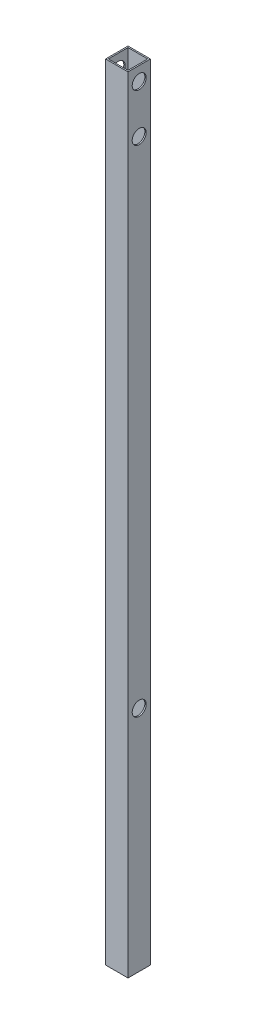
from build123d import *

# Parameters (mm, degrees)
SKETCH1_W               = 25.4
SKETCH1_H               = 25.4
SKETCH1_W_2             = 22.352
SKETCH1_H_2             = 22.352
BOSS_EXTRUDE1_DEPTH     = 889
CUT_EXTRUDE3_DEPTH      = 891.78839291
CUT_EXTRUDE3_DEPTH_BACK = 891.78839291
SKETCH5_R               = 7.9375
CUT_EXTRUDE4_DEPTH      = 891.78839291
CUT_EXTRUDE4_DEPTH_BACK = 891.78839291
SKETCH6_R               = 7.9375


with BuildPart() as part:
    # Sketch1 → Boss-Extrude1 (new body)
    with BuildSketch(Plane(origin=(0, 0, 0), x_dir=(1, 0, 0), z_dir=(0, 1, 0))):
        with Locations((-46.655111286, 37.676591231)):
            Rectangle(SKETCH1_W, SKETCH1_H)
        with Locations((-46.655111286, 37.676591231)):
            Rectangle(SKETCH1_W_2, SKETCH1_H_2, mode=Mode.SUBTRACT)
    extrude(amount=BOSS_EXTRUDE1_DEPTH)

    # Sketch5 → Cut-Extrude3 (cut, two sides: drawn at the far end of the back side and taken through both)
    with BuildSketch(Plane(origin=(-33.955111286, 0, 0), x_dir=(0, 0, -1), z_dir=(1, 0, 0)).offset(-CUT_EXTRUDE3_DEPTH_BACK)):
        with Locations((37.676591231, 258.318)):
            Circle(SKETCH5_R)
    extrude(amount=CUT_EXTRUDE3_DEPTH + CUT_EXTRUDE3_DEPTH_BACK, mode=Mode.SUBTRACT)

    # Sketch6 → Cut-Extrude4 (cut, two sides: drawn at the far end of the back side and taken through both)
    with BuildSketch(Plane(origin=(-33.955111286, 0, 0), x_dir=(0, 0, -1), z_dir=(1, 0, 0)).offset(-CUT_EXTRUDE4_DEPTH_BACK)):
        with Locations((37.676591231, 873.125)):
            Circle(SKETCH6_R)
        with Locations((37.676591231, 819.277)):
            Circle(SKETCH6_R)
    extrude(amount=CUT_EXTRUDE4_DEPTH + CUT_EXTRUDE4_DEPTH_BACK, mode=Mode.SUBTRACT)


solid = part.part
